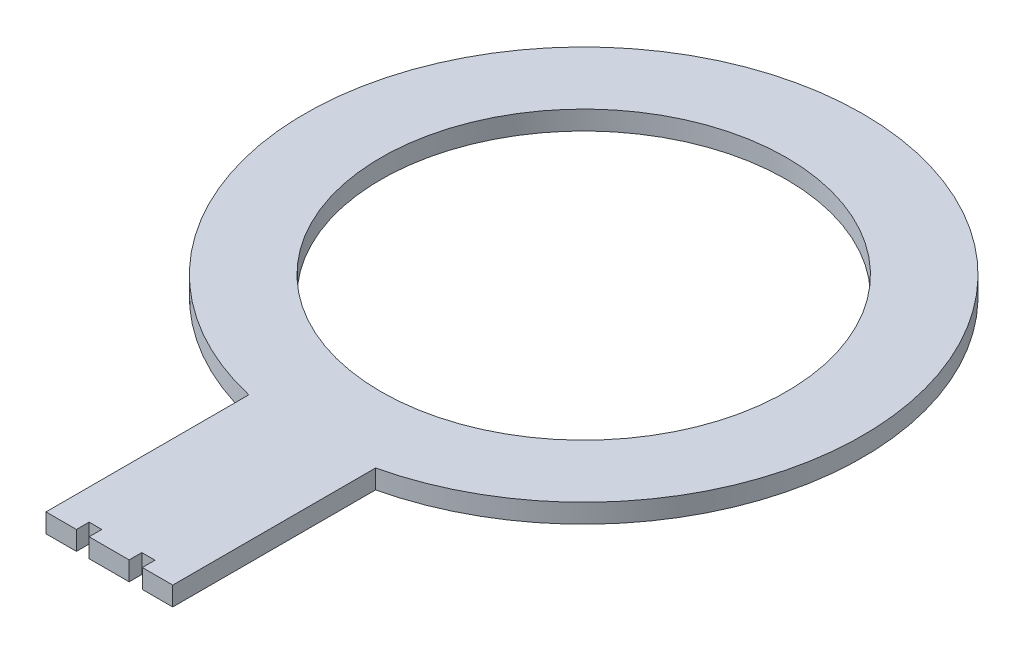
from build123d import *

# Parameters (mm, degrees)
SKETCH1_R           = 50.8
BOSS_EXTRUDE1_DEPTH = 4.7625


with BuildPart() as part:
    # Sketch1 → Boss-Extrude1 (new body)
    with BuildSketch(Plane(origin=(0, 0, 0), x_dir=(1, 0, 0), z_dir=(0, 1, 0))):
        with BuildLine():
            Line((-15.875, -118.822105782), (-8.255, -118.822105782))
            Line((-8.255, -118.822105782), (-8.255, -115.647105782))
            Line((-8.255, -115.647105782), (-5.08, -115.647105782))
            Line((-5.08, -115.647105782), (-5.08, -118.822105782))
            Line((-5.08, -118.822105782), (4.953, -118.822105782))
            Line((4.953, -118.822105782), (4.953, -115.647105782))
            Line((4.953, -115.647105782), (8.255, -115.647105782))
            Line((8.255, -115.647105782), (8.255, -118.822105782))
            Line((8.255, -118.822105782), (15.875, -118.822105782))
            Line((15.875, -118.822105782), (15.875, -68.022105782))
            ThreePointArc((15.875, -68.022105782), (0, 69.85), (-15.875, -68.022105782))
            Line((-15.875, -68.022105782), (-15.875, -118.822105782))
        make_face()
        Circle(SKETCH1_R, mode=Mode.SUBTRACT)
    extrude(amount=BOSS_EXTRUDE1_DEPTH)


solid = part.part
